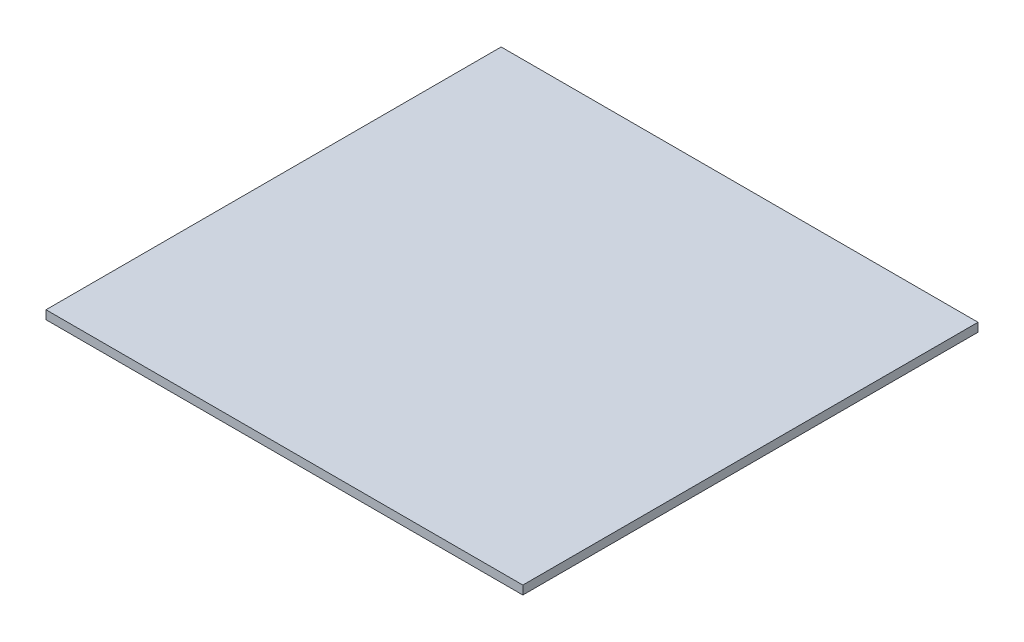
from build123d import *

# Parameters (mm, degrees)
SKETCH_1_W             = 1100
SKETCH_1_H             = 1050
SM_BASE_FLANGE_1_DEPTH = 20


# Sheet-metal steps are written as plain solids
with BuildPart() as part:
    # Sketch 1 → Базовая кромка1 (new body)
    with BuildSketch(Plane(origin=(0, 0, 0), x_dir=(1, 0, 0), z_dir=(0, 1, 0))):
        with Locations((491.577466865, -485.166454681)):
            Rectangle(SKETCH_1_W, SKETCH_1_H)
    extrude(amount=-SM_BASE_FLANGE_1_DEPTH)


solid = part.part
